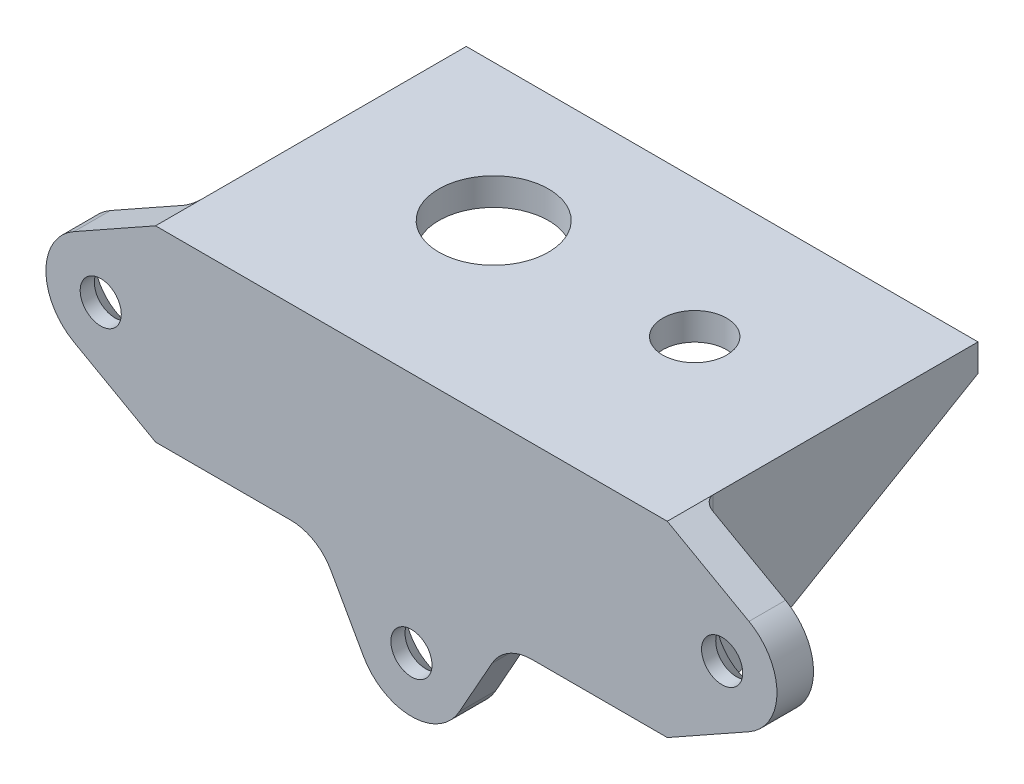
from build123d import *

# Parameters (mm, degrees)
SKETCH1_W                                       = 50
SKETCH1_H                                       = 30
SKETCH1_R                                       = 6
SKETCH1_R_2                                     = 3.5
BOSS_EXTRUDE1_DEPTH                             = 3
SKETCH2_W                                       = 50
SKETCH2_H                                       = 20.5
BOSS_EXTRUDE2_DEPTH                             = 4
BOSS_EXTRUDE3_DEPTH                             = 3
BOSS_EXTRUDE4_START                             = -50
BOSS_EXTRUDE4_DEPTH                             = 3
BOSS_EXTRUDE5_DEPTH                             = 4
CSK_FOR_M4_FLAT_HEAD_MACHINE_SCREW1_D           = 4.5
CSK_FOR_M4_FLAT_HEAD_MACHINE_SCREW1_DEPTH       = 10
CSK_FOR_M4_FLAT_HEAD_MACHINE_SCREW1_CSINK_D     = 9.4
CSK_FOR_M4_FLAT_HEAD_MACHINE_SCREW1_CSINK_ANGLE = 90
CSK_FOR_M4_FLAT_HEAD_MACHINE_SCREW1_TIP         = 1.351936393
FILLET1_R                                       = 5
FILLET2_R                                       = 1


with BuildPart() as part:
    # Sketch1 → Boss-Extrude1 (new body)
    with BuildSketch(Plane(origin=(0, 0, 0), x_dir=(1, 0, 0), z_dir=(0, 1, 0))):
        Rectangle(SKETCH1_W, SKETCH1_H)
        with Locations(Location((-10, 0, 0), (0, 0, 270))):
            Circle(SKETCH1_R, mode=Mode.SUBTRACT)
        with Locations(Location((12, 0, 0), (0, 0, 270))):
            Circle(SKETCH1_R_2, mode=Mode.SUBTRACT)
    extrude(amount=BOSS_EXTRUDE1_DEPTH)

    # Sketch2 → Boss-Extrude2 (add)
    with BuildSketch(Plane.XY.offset(15)):
        with Locations((0, -7.25)):
            Rectangle(SKETCH2_W, SKETCH2_H)
    extrude(amount=BOSS_EXTRUDE2_DEPTH)

    # Sketch3 → Boss-Extrude3 (add)
    with BuildSketch(Plane.ZY.offset(25)):
        Polygon((-15, 3), (-15, 0), (15, -17.5), (19, -17.5), (19, 3), align=None)
    extrude(amount=BOSS_EXTRUDE3_DEPTH)

    # Sketch3<2> → Boss-Extrude4 (add)
    with BuildSketch(Plane.ZY.offset(25).offset(BOSS_EXTRUDE4_START)):
        Polygon((-15, 3), (-15, 0), (15, -17.5), (19, -17.5), (19, 3), align=None)
    extrude(amount=-BOSS_EXTRUDE4_DEPTH)

    # Sketch5 → Boss-Extrude5 (add)
    with BuildSketch(Plane.XY.offset(19)):
        with BuildLine():
            Line((-28, 3), (-36.937527692, -2.018276473))
            ThreePointArc((-36.937527692, -2.018276473), (-40, -7.25), (-36.937527692, -12.481723527))
            Line((-36.937527692, -12.481723527), (-28, -17.5))
            Line((-28, -17.5), (-28, 3))
        make_face()
        with BuildLine():
            Line((28, 3), (36.937527692, -2.018276473))
            ThreePointArc((36.937527692, -2.018276473), (40, -7.25), (36.937527692, -12.481723527))
            Line((36.937527692, -12.481723527), (28, -17.5))
            Line((28, -17.5), (28, 3))
        make_face()
        with BuildLine():
            Line((10.25, -17.5), (-10.25, -17.5))
            Line((-10.25, -17.5), (-5.231723527, -26.437527692))
            ThreePointArc((-5.231723527, -26.437527692), (0, -29.5), (5.231723527, -26.437527692))
            Line((5.231723527, -26.437527692), (10.25, -17.5))
        make_face()
    extrude(amount=-BOSS_EXTRUDE5_DEPTH)

    # CSK for M4 Flat Head Machine Screw1
    with Locations(Plane(origin=(0, 0, 15), x_dir=(-1, 0, 0), z_dir=(0, 0, -1))):
        with Locations((-34, -7.25), (34, -7.25), (0, -23.5)):
            CounterSinkHole(CSK_FOR_M4_FLAT_HEAD_MACHINE_SCREW1_D / 2, CSK_FOR_M4_FLAT_HEAD_MACHINE_SCREW1_CSINK_D / 2, depth=CSK_FOR_M4_FLAT_HEAD_MACHINE_SCREW1_DEPTH, counter_sink_angle=CSK_FOR_M4_FLAT_HEAD_MACHINE_SCREW1_CSINK_ANGLE)
            with Locations((0, 0, -(CSK_FOR_M4_FLAT_HEAD_MACHINE_SCREW1_DEPTH + CSK_FOR_M4_FLAT_HEAD_MACHINE_SCREW1_TIP / 2))):  # 118° drill point
                Cone(0, CSK_FOR_M4_FLAT_HEAD_MACHINE_SCREW1_D / 2, CSK_FOR_M4_FLAT_HEAD_MACHINE_SCREW1_TIP, mode=Mode.SUBTRACT)

    # Fillet1
    fillet1_edges = [part.edges().sort_by_distance(p)[0] for p in [
        (-10.25, -17.5, 17),
        (10.25, -17.5, 17),
    ]]
    fillet(fillet1_edges, radius=FILLET1_R)

    # Fillet2
    # the kernel refuses this fillet: 1 mm, written as the material it adds along each edge
    with BuildSketch(Plane(origin=(-24, -1, 14), x_dir=(0, 1, 0), z_dir=(0, 0, 1))) as fillet2_piece_1_section:
        Polygon((0, 0), (FILLET2_R, 0), (FILLET2_R, FILLET2_R), (0, FILLET2_R), align=None)
    fillet2_piece_1 = extrude(amount=FILLET2_R, mode=Mode.PRIVATE)
    fillet2_piece_1 = fillet2_piece_1 - Plane(origin=(-24, -1, 14), x_dir=(0.7071067811865475, -0.7071067811865475, 0), z_dir=(0, 0, 1)) * Sphere(FILLET2_R, mode=Mode.PRIVATE)
    add(fillet2_piece_1)
    with BuildSketch(Plane(origin=(24, -1, 14), x_dir=(1, 0, 0), z_dir=(0, 0, 1))) as fillet2_piece_2_section:
        Polygon((0, 0), (FILLET2_R, 0), (FILLET2_R, FILLET2_R), (0, FILLET2_R), align=None)
    fillet2_piece_2 = extrude(amount=FILLET2_R, mode=Mode.PRIVATE)
    fillet2_piece_2 = fillet2_piece_2 - Plane(origin=(24, -1, 14), x_dir=(-0.7071067811865475, -0.7071067811865475, 0), z_dir=(0, 0, 1)) * Sphere(FILLET2_R, mode=Mode.PRIVATE)
    add(fillet2_piece_2)
    with BuildSketch(Plane(origin=(-25, -17.5, 15), x_dir=(1, 0, 0), z_dir=(0, 1, 0))) as fillet2_piece_3_section:
        with BuildLine():
            CenterArc((FILLET2_R, FILLET2_R), FILLET2_R, 180, 90)
            Line((0, FILLET2_R), (0, 0))
            Line((0, 0), (FILLET2_R, 0))
        make_face()
    fillet2_piece_3 = extrude(amount=16.5, mode=Mode.PRIVATE)
    fillet2_piece_3 = split(fillet2_piece_3, bisect_by=Plane(origin=(-24.77263385, -15.290921561, 11.213008391), z_dir=(0, 0.8637789008984336, 0.5038710255240861)), keep=Keep.TOP, mode=Mode.PRIVATE)
    add(fillet2_piece_3)
    with BuildSketch(Plane(origin=(25, -1, 15), x_dir=(-1, 0, 0), z_dir=(0, -1, 0))) as fillet2_piece_4_section:
        with BuildLine():
            CenterArc((FILLET2_R, FILLET2_R), FILLET2_R, 180, 90)
            Line((0, FILLET2_R), (0, 0))
            Line((0, 0), (FILLET2_R, 0))
        make_face()
    fillet2_piece_4 = extrude(amount=16.5, mode=Mode.PRIVATE)
    fillet2_piece_4 = split(fillet2_piece_4, bisect_by=Plane(origin=(24.77263385, -15.290921561, 11.213008391), z_dir=(0, 0.8637789008984336, 0.5038710255240861)), keep=Keep.TOP, mode=Mode.PRIVATE)
    add(fillet2_piece_4)
    with BuildSketch(Plane(origin=(24, 0, 15), x_dir=(0, -1, 0), z_dir=(-1, 0, 0))) as fillet2_piece_5:
        with BuildLine():
            CenterArc((FILLET2_R, -FILLET2_R), FILLET2_R, 90, 90)
            Line((0, -FILLET2_R), (0, 0))
            Line((0, 0), (FILLET2_R, 0))
        make_face()
    extrude(amount=48)
    with BuildSketch(Plane(origin=(-25, 0, 14), x_dir=(1, 0, 0), z_dir=(0, 0, -1))) as fillet2_piece_6_section:
        with BuildLine():
            CenterArc((FILLET2_R, FILLET2_R), FILLET2_R, 180, 90)
            Line((0, FILLET2_R), (0, 0))
            Line((0, 0), (FILLET2_R, 0))
        make_face()
    fillet2_piece_6 = extrude(amount=29, mode=Mode.PRIVATE)
    fillet2_piece_6 = split(fillet2_piece_6, bisect_by=Plane(origin=(-24.77197237, -6.451381469, -3.94048891), z_dir=(0, 0.8637789008984336, 0.5038710255240861)), keep=Keep.TOP, mode=Mode.PRIVATE)
    add(fillet2_piece_6)
    with BuildSketch(Plane(origin=(25, 0, -15), x_dir=(0, -1, 0), z_dir=(0, 0, 1))) as fillet2_piece_7_section:
        with BuildLine():
            CenterArc((FILLET2_R, -FILLET2_R), FILLET2_R, 90, 90)
            Line((0, -FILLET2_R), (0, 0))
            Line((0, 0), (FILLET2_R, 0))
        make_face()
    fillet2_piece_7 = extrude(amount=29, mode=Mode.PRIVATE)
    fillet2_piece_7 = split(fillet2_piece_7, bisect_by=Plane(origin=(24.77197237, -6.451381469, -3.94048891), z_dir=(0, 0.8637789008984336, 0.5038710255240861)), keep=Keep.TOP, mode=Mode.PRIVATE)
    add(fillet2_piece_7)
    with BuildSketch(Plane(origin=(-28, -20, 15), x_dir=(0, 0, -1), z_dir=(0, 1, 0))) as fillet2_piece_8_section:
        with BuildLine():
            CenterArc((FILLET2_R, FILLET2_R), FILLET2_R, 180, 90)
            Line((0, FILLET2_R), (0, 0))
            Line((0, 0), (FILLET2_R, 0))
        make_face()
    fillet2_piece_8 = extrude(amount=23, mode=Mode.PRIVATE)
    fillet2_piece_8 = split(fillet2_piece_8, bisect_by=Plane(origin=(-28.224621948, -14.787732132, 10.350397941), z_dir=(0, 0.8637789008984336, 0.5038710255240861)), keep=Keep.TOP, mode=Mode.PRIVATE)
    fillet2_piece_8 = split(fillet2_piece_8, bisect_by=Plane(origin=(-32.565520465, -14.936534495, 14.773416923), z_dir=(0.48958794860434196, 0.8719539211342491, 0)), keep=Keep.TOP, mode=Mode.PRIVATE)
    fillet2_piece_8 = split(fillet2_piece_8, bisect_by=Plane(origin=(-32.527453001, 0.457908757, 14.773416923), z_dir=(0.48958794860434235, -0.8719539211342491, 0)), keep=Keep.TOP, mode=Mode.PRIVATE)
    add(fillet2_piece_8)
    with BuildSketch(Plane(origin=(28, -20, 15), x_dir=(1, 0, 0), z_dir=(0, 1, 0))) as fillet2_piece_9_section:
        with BuildLine():
            CenterArc((FILLET2_R, FILLET2_R), FILLET2_R, 180, 90)
            Line((0, FILLET2_R), (0, 0))
            Line((0, 0), (FILLET2_R, 0))
        make_face()
    fillet2_piece_9 = extrude(amount=23, mode=Mode.PRIVATE)
    fillet2_piece_9 = split(fillet2_piece_9, bisect_by=Plane(origin=(32.565520464, -14.936534495, 14.773416923), z_dir=(-0.48958794860434196, 0.8719539211342491, 0)), keep=Keep.TOP, mode=Mode.PRIVATE)
    fillet2_piece_9 = split(fillet2_piece_9, bisect_by=Plane(origin=(28.224621948, -14.787732132, 10.350397941), z_dir=(0, 0.8637789008984336, 0.5038710255240861)), keep=Keep.TOP, mode=Mode.PRIVATE)
    fillet2_piece_9 = split(fillet2_piece_9, bisect_by=Plane(origin=(32.527453001, 0.457908757, 14.773416923), z_dir=(-0.48958794860434235, -0.8719539211342491, 0)), keep=Keep.TOP, mode=Mode.PRIVATE)
    add(fillet2_piece_9)


solid = part.part
